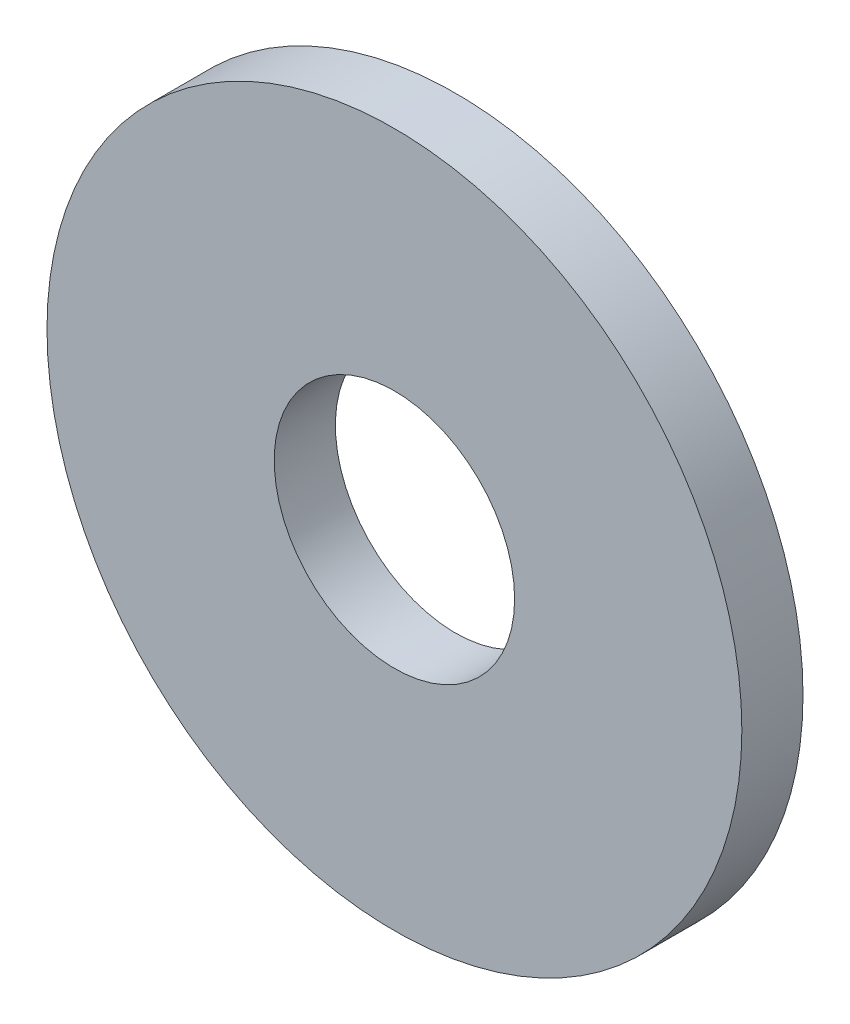
from build123d import *

# Parameters (mm, degrees)
SKETCH1_R           = 31.75
BOSS_EXTRUDE1_DEPTH = 5.588
CAVITY1_OUTLINE_R   = 10.9855
CAVITY1_DEPTH       = 5.588


# Read off the part's stored shape, not the designer's step: Cavity1
with BuildPart() as part:
    # Sketch1 → Boss-Extrude1 (new body)
    with BuildSketch(Plane.XY):
        Circle(SKETCH1_R)
    extrude(amount=BOSS_EXTRUDE1_DEPTH)

    # Cavity1 outline → Cavity1 (cut)
    with BuildSketch(Plane.XY):
        Circle(CAVITY1_OUTLINE_R)
    extrude(amount=CAVITY1_DEPTH, mode=Mode.SUBTRACT)


solid = part.part
